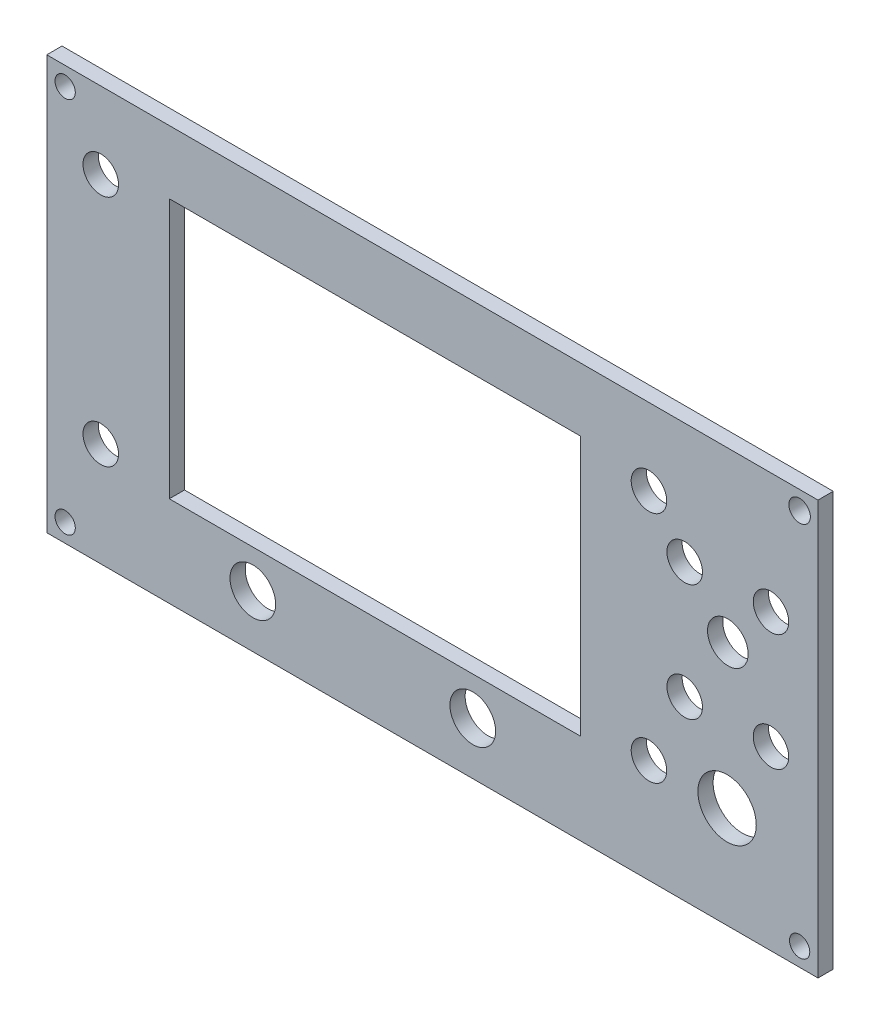
from build123d import *

# Parameters (mm, degrees)
ESQUISSE1_R        = 3.5
ESQUISSE1_R_2      = 4
ESQUISSE1_R_3      = 5.75
ESQUISSE1_R_4      = 4.5
ESQUISSE1_W        = 81
ESQUISSE1_H        = 51.2
BOSS_EXTRU_1_DEPTH = 3
ESQUISSE2_W        = 7.242640687
ESQUISSE2_H        = 7.242640687
ESQUISSE2_R        = 2
ESQUISSE2_R_2      = 2.113486369
BOSS_EXTRU_2_DEPTH = 3


with BuildPart() as part:
    # Esquisse1 → Boss.-Extru.1 (new body)
    with BuildSketch(Plane.XY.offset(0.8)):
        with BuildLine():
            Line((-112.589634865, 39.905491149), (24.864852981, 39.905491149))
            Line((24.864852981, 39.905491149), (24.864852981, 35.662850462))
            ThreePointArc((24.864852981, 35.662850462), (25.743532637, 33.541530119), (27.864852981, 32.662850462))
            Line((27.864852981, 32.662850462), (32.107493668, 32.662850462))
            Line((32.107493668, 32.662850462), (32.107493668, -34.39608502))
            Line((32.107493668, -34.39608502), (27.864852981, -34.39608502))
            ThreePointArc((27.864852981, -34.39608502), (25.743532637, -35.274764676), (24.864852981, -37.39608502))
            Line((24.864852981, -37.39608502), (24.864852981, -41.638725707))
            Line((24.864852981, -41.638725707), (-112.589634865, -41.638725707))
            Line((-112.589634865, -41.638725707), (-112.589634865, -37.39608502))
            ThreePointArc((-112.589634865, -37.39608502), (-113.468314521, -35.274764676), (-115.589634865, -34.39608502))
            Line((-115.589634865, -34.39608502), (-119.832275552, -34.39608502))
            Line((-119.832275552, -34.39608502), (-119.832275552, 32.662850462))
            Line((-119.832275552, 32.662850462), (-115.589634865, 32.662850462))
            ThreePointArc((-115.589634865, 32.662850462), (-113.468314521, 33.541530119), (-112.589634865, 35.662850462))
            Line((-112.589634865, 35.662850462), (-112.589634865, 39.905491149))
        make_face()
        with Locations((-109.194417438, 24.821428571)):
            Circle(ESQUISSE1_R, mode=Mode.SUBTRACT)
        with Locations((-1.194417438, 24.821428571)):
            Circle(ESQUISSE1_R, mode=Mode.SUBTRACT)
        with Locations((-1.194417438, -21.178571429)):
            Circle(ESQUISSE1_R, mode=Mode.SUBTRACT)
        with Locations((-109.194417438, -21.178571429)):
            Circle(ESQUISSE1_R, mode=Mode.SUBTRACT)
        with Locations((14.345224597, 6.749852674)):
            Circle(ESQUISSE1_R_2, mode=Mode.SUBTRACT)
        with Locations((5.845224597, 16.204342535)):
            Circle(ESQUISSE1_R, mode=Mode.SUBTRACT)
        with Locations((22.845224597, 16.204342535)):
            Circle(ESQUISSE1_R, mode=Mode.SUBTRACT)
        with Locations((22.845224597, -6.795657465)):
            Circle(ESQUISSE1_R, mode=Mode.SUBTRACT)
        with Locations((5.845224597, -6.795657465)):
            Circle(ESQUISSE1_R, mode=Mode.SUBTRACT)
        with Locations((14.194599357, -21.638725707)):
            Circle(ESQUISSE1_R_3, mode=Mode.SUBTRACT)
        with Locations((-35.905557573, -31.316718293)):
            Circle(ESQUISSE1_R_4, mode=Mode.SUBTRACT)
        with Locations((-79.237508709, -31.316718293)):
            Circle(ESQUISSE1_R_4, mode=Mode.SUBTRACT)
        with Locations((-55.194417438, 1.821428571)):
            Rectangle(ESQUISSE1_W, ESQUISSE1_H, mode=Mode.SUBTRACT)
    extrude(amount=BOSS_EXTRU_1_DEPTH)

    # Esquisse2 → Boss.-Extru.2 (add)
    # profile 1 of 4: a face of its own
    with BuildSketch(Plane.XY.offset(0.8)):
        with Locations((-116.210955209, -38.017405364)):
            Rectangle(ESQUISSE2_W, ESQUISSE2_H)
        with Locations((-116.210955208, -38.017405363)):
            Circle(ESQUISSE2_R, mode=Mode.SUBTRACT)
    # profile 2 of 4: a face of its own
    with BuildSketch(Plane.XY.offset(0.8)):
        with Locations((28.486173325, -38.017405364)):
            Rectangle(ESQUISSE2_W, ESQUISSE2_H)
        with Locations((28.486173324, -38.017405363)):
            Circle(ESQUISSE2_R, mode=Mode.SUBTRACT)
    # profile 3 of 4: a face of its own
    with BuildSketch(Plane.XY.offset(0.8)):
        with Locations((-116.210955209, 36.284170805)):
            Rectangle(ESQUISSE2_W, ESQUISSE2_H)
        with Locations((-116.210955208, 36.284170806)):
            Circle(ESQUISSE2_R, mode=Mode.SUBTRACT)
    # profile 4 of 4: a face of its own
    with BuildSketch(Plane.XY.offset(0.8)):
        with Locations((28.486173325, 36.284170805)):
            Rectangle(ESQUISSE2_W, ESQUISSE2_H)
        with Locations((28.486173324, 36.284170806)):
            Circle(ESQUISSE2_R_2, mode=Mode.SUBTRACT)
    extrude(amount=BOSS_EXTRU_2_DEPTH)


solid = part.part
